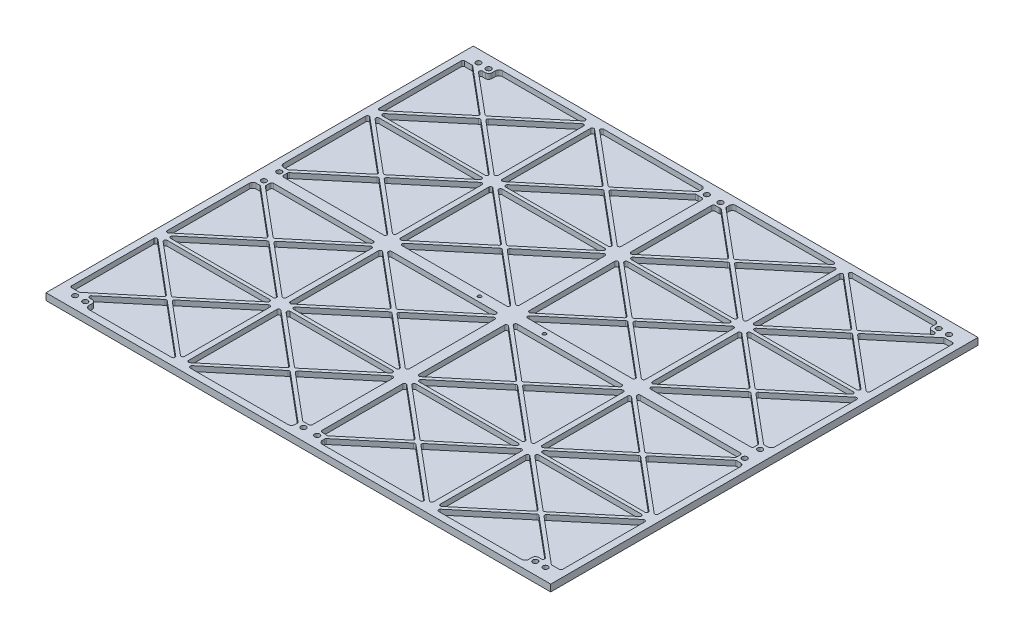
from build123d import *

# Parameters (mm, degrees)
SKETCH1_W               = 295.3
SKETCH1_H               = 250
BOSS_EXTRUDE1_DEPTH     = 4
CUT_EXTRUDE1_DEPTH      = 3
LPATTERN1_COUNT         = 2
LPATTERN1_PITCH         = 72
MIRROR1_COPY_1_DEPTH    = 3
MIRROR2_COPY_1_DEPTH    = 3
MIRROR2_COPY_2_DEPTH    = 3
MIRROR2_COPY_3_DEPTH    = 3
MIRROR3_COPY_1_DEPTH    = 3
MIRROR3_COPY_2_DEPTH    = 3
MIRROR3_COPY_3_DEPTH    = 3
MIRROR3_COPY_4_DEPTH    = 3
MIRROR3_COPY_5_DEPTH    = 3
MIRROR3_COPY_6_DEPTH    = 3
MIRROR3_COPY_7_DEPTH    = 3
SKETCH4_R               = 1.5
BOSS_EXTRUDE2_DEPTH     = 3
CUT_EXTRUDE2_START      = -4
SKETCH4_3_R             = 1.5
CUT_EXTRUDE2_DEPTH      = 4
FILLET1_R               = 1
CUT_EXTRUDE3_DEPTH      = 194.498120146
CUT_EXTRUDE3_DEPTH_BACK = 194.498120146
SKETCH5_R               = 1


with BuildPart() as part:
    # Sketch1 → Boss-Extrude1 (new body)
    with BuildSketch(Plane(origin=(0, 0, 0), x_dir=(1, 0, 0), z_dir=(0, 1, 0))):
        Rectangle(SKETCH1_W, SKETCH1_H)
    extrude(amount=BOSS_EXTRUDE1_DEPTH)

    # Sketch2 → Cut-Extrude1 (cut)
    with BuildSketch(Plane(origin=(0, 4, 0), x_dir=(1, 0, 0), z_dir=(0, 1, 0))):
        with BuildLine():
            Line((-74.825, 66.784773493), (-74.825, 116.715226507))
            ThreePointArc((-74.825, 116.715226507), (-75.402038293, 117.621374063), (-76.467206788, 117.481757942))
            Line((-76.467206788, 117.481757942), (-106.265445093, 92.516531435))
            ThreePointArc((-106.265445093, 92.516531435), (-106.623238305, 91.75), (-106.265445093, 90.983468565))
            Line((-106.265445093, 90.983468565), (-76.467206788, 66.018242058))
            ThreePointArc((-76.467206788, 66.018242058), (-75.402038293, 65.878625937), (-74.825, 66.784773493))
        make_face()
        with BuildLine():
            Line((-143.65, 117.553035315), (-143.65, 65.946964685))
            ThreePointArc((-143.65, 65.946964685), (-143.072961707, 65.040817129), (-142.007793212, 65.18043325))
            Line((-142.007793212, 65.18043325), (-111.209554907, 90.983468565))
            ThreePointArc((-111.209554907, 90.983468565), (-110.851761695, 91.75), (-111.209554907, 92.516531435))
            Line((-111.209554907, 92.516531435), (-142.007793212, 118.31956675))
            ThreePointArc((-142.007793212, 118.31956675), (-143.072961707, 118.459182871), (-143.65, 117.553035315))
        make_face()
        with BuildLine():
            Line((-139.98435535, 119.233468565), (-109.379706788, 93.592624442))
            ThreePointArc((-109.379706788, 93.592624442), (-108.7375, 93.359155878), (-108.095293212, 93.592624442))
            Line((-108.095293212, 93.592624442), (-77.49064465, 119.233468565))
            ThreePointArc((-77.49064465, 119.233468565), (-77.193029265, 120.34166399), (-78.132851438, 121))
            Line((-78.132851438, 121), (-139.342148562, 121))
            ThreePointArc((-139.342148562, 121), (-140.281970735, 120.34166399), (-139.98435535, 119.233468565))
        make_face()
        with BuildLine():
            Line((-108.095293212, 89.907375558), (-78.087439522, 64.766531435))
            ThreePointArc((-78.087439522, 64.766531435), (-77.789824137, 63.65833601), (-78.72964631, 63))
            Line((-78.72964631, 63), (-138.74535369, 63))
            ThreePointArc((-138.74535369, 63), (-139.685175863, 63.65833601), (-139.387560478, 64.766531435))
            Line((-139.387560478, 64.766531435), (-109.379706788, 89.907375558))
            ThreePointArc((-109.379706788, 89.907375558), (-108.7375, 90.140844122), (-108.095293212, 89.907375558))
        make_face()
    cut_extrude1 = extrude(amount=-CUT_EXTRUDE1_DEPTH, mode=Mode.SUBTRACT)

    # LPattern1: Cut-Extrude1 ×2
    with Locations(*[(i * LPATTERN1_PITCH, 0, 0) for i in range(1, LPATTERN1_COUNT)]):
        add(cut_extrude1, mode=Mode.SUBTRACT)

    # Mirror1: Cut-Extrude1 across plane
    add(cut_extrude1.mirror(Plane(origin=(0, 0, -62), x_dir=(1, 0, 0), z_dir=(0, 0, -1))), mode=Mode.SUBTRACT)

    # Mirror1 copy 1 sketch → Mirror1 copy 1 (cut)
    with BuildSketch(Plane(origin=(72, 4, -124), x_dir=(1, 0, 0), z_dir=(0, 1, 0))):
        with BuildLine():
            Line((-74.825, -66.784773493), (-74.825, -116.715226507))
            ThreePointArc((-74.825, -116.715226507), (-75.402038293, -117.621374063), (-76.467206788, -117.481757942))
            Line((-76.467206788, -117.481757942), (-106.265445093, -92.516531435))
            ThreePointArc((-106.265445093, -92.516531435), (-106.623238305, -91.75), (-106.265445093, -90.983468565))
            Line((-106.265445093, -90.983468565), (-76.467206788, -66.018242058))
            ThreePointArc((-76.467206788, -66.018242058), (-75.402038293, -65.878625937), (-74.825, -66.784773493))
        make_face()
        with BuildLine():
            Line((-143.65, -117.553035315), (-143.65, -65.946964685))
            ThreePointArc((-143.65, -65.946964685), (-143.072961707, -65.040817129), (-142.007793212, -65.18043325))
            Line((-142.007793212, -65.18043325), (-111.209554907, -90.983468565))
            ThreePointArc((-111.209554907, -90.983468565), (-110.851761695, -91.75), (-111.209554907, -92.516531435))
            Line((-111.209554907, -92.516531435), (-142.007793212, -118.31956675))
            ThreePointArc((-142.007793212, -118.31956675), (-143.072961707, -118.459182871), (-143.65, -117.553035315))
        make_face()
        with BuildLine():
            Line((-139.98435535, -119.233468565), (-109.379706788, -93.592624442))
            ThreePointArc((-109.379706788, -93.592624442), (-108.7375, -93.359155878), (-108.095293212, -93.592624442))
            Line((-108.095293212, -93.592624442), (-77.49064465, -119.233468565))
            ThreePointArc((-77.49064465, -119.233468565), (-77.193029265, -120.34166399), (-78.132851438, -121))
            Line((-78.132851438, -121), (-139.342148562, -121))
            ThreePointArc((-139.342148562, -121), (-140.281970735, -120.34166399), (-139.98435535, -119.233468565))
        make_face()
        with BuildLine():
            Line((-108.095293212, -89.907375558), (-78.087439522, -64.766531435))
            ThreePointArc((-78.087439522, -64.766531435), (-77.789824137, -63.65833601), (-78.72964631, -63))
            Line((-78.72964631, -63), (-138.74535369, -63))
            ThreePointArc((-138.74535369, -63), (-139.685175863, -63.65833601), (-139.387560478, -64.766531435))
            Line((-139.387560478, -64.766531435), (-109.379706788, -89.907375558))
            ThreePointArc((-109.379706788, -89.907375558), (-108.7375, -90.140844122), (-108.095293212, -89.907375558))
        make_face()
    extrude(amount=-MIRROR1_COPY_1_DEPTH, mode=Mode.SUBTRACT)

    # Mirror2: Cut-Extrude1 across plane
    add(cut_extrude1.mirror(Plane.XY), mode=Mode.SUBTRACT)

    # Mirror2 copy 1 sketch → Mirror2 copy 1 (cut)
    with BuildSketch(Plane(origin=(72, 4, 0), x_dir=(1, 0, 0), z_dir=(0, 1, 0))):
        with BuildLine():
            Line((-74.825, -66.784773493), (-74.825, -116.715226507))
            ThreePointArc((-74.825, -116.715226507), (-75.402038293, -117.621374063), (-76.467206788, -117.481757942))
            Line((-76.467206788, -117.481757942), (-106.265445093, -92.516531435))
            ThreePointArc((-106.265445093, -92.516531435), (-106.623238305, -91.75), (-106.265445093, -90.983468565))
            Line((-106.265445093, -90.983468565), (-76.467206788, -66.018242058))
            ThreePointArc((-76.467206788, -66.018242058), (-75.402038293, -65.878625937), (-74.825, -66.784773493))
        make_face()
        with BuildLine():
            Line((-143.65, -117.553035315), (-143.65, -65.946964685))
            ThreePointArc((-143.65, -65.946964685), (-143.072961707, -65.040817129), (-142.007793212, -65.18043325))
            Line((-142.007793212, -65.18043325), (-111.209554907, -90.983468565))
            ThreePointArc((-111.209554907, -90.983468565), (-110.851761695, -91.75), (-111.209554907, -92.516531435))
            Line((-111.209554907, -92.516531435), (-142.007793212, -118.31956675))
            ThreePointArc((-142.007793212, -118.31956675), (-143.072961707, -118.459182871), (-143.65, -117.553035315))
        make_face()
        with BuildLine():
            Line((-139.98435535, -119.233468565), (-109.379706788, -93.592624442))
            ThreePointArc((-109.379706788, -93.592624442), (-108.7375, -93.359155878), (-108.095293212, -93.592624442))
            Line((-108.095293212, -93.592624442), (-77.49064465, -119.233468565))
            ThreePointArc((-77.49064465, -119.233468565), (-77.193029265, -120.34166399), (-78.132851438, -121))
            Line((-78.132851438, -121), (-139.342148562, -121))
            ThreePointArc((-139.342148562, -121), (-140.281970735, -120.34166399), (-139.98435535, -119.233468565))
        make_face()
        with BuildLine():
            Line((-108.095293212, -89.907375558), (-78.087439522, -64.766531435))
            ThreePointArc((-78.087439522, -64.766531435), (-77.789824137, -63.65833601), (-78.72964631, -63))
            Line((-78.72964631, -63), (-138.74535369, -63))
            ThreePointArc((-138.74535369, -63), (-139.685175863, -63.65833601), (-139.387560478, -64.766531435))
            Line((-139.387560478, -64.766531435), (-109.379706788, -89.907375558))
            ThreePointArc((-109.379706788, -89.907375558), (-108.7375, -90.140844122), (-108.095293212, -89.907375558))
        make_face()
    extrude(amount=-MIRROR2_COPY_1_DEPTH, mode=Mode.SUBTRACT)

    # Mirror2 copy 2 sketch → Mirror2 copy 2 (cut)
    with BuildSketch(Plane(origin=(0, 4, 124), x_dir=(1, 0, 0), z_dir=(0, 1, 0))):
        with BuildLine():
            Line((-74.825, 66.784773493), (-74.825, 116.715226507))
            ThreePointArc((-74.825, 116.715226507), (-75.402038293, 117.621374063), (-76.467206788, 117.481757942))
            Line((-76.467206788, 117.481757942), (-106.265445093, 92.516531435))
            ThreePointArc((-106.265445093, 92.516531435), (-106.623238305, 91.75), (-106.265445093, 90.983468565))
            Line((-106.265445093, 90.983468565), (-76.467206788, 66.018242058))
            ThreePointArc((-76.467206788, 66.018242058), (-75.402038293, 65.878625937), (-74.825, 66.784773493))
        make_face()
        with BuildLine():
            Line((-143.65, 117.553035315), (-143.65, 65.946964685))
            ThreePointArc((-143.65, 65.946964685), (-143.072961707, 65.040817129), (-142.007793212, 65.18043325))
            Line((-142.007793212, 65.18043325), (-111.209554907, 90.983468565))
            ThreePointArc((-111.209554907, 90.983468565), (-110.851761695, 91.75), (-111.209554907, 92.516531435))
            Line((-111.209554907, 92.516531435), (-142.007793212, 118.31956675))
            ThreePointArc((-142.007793212, 118.31956675), (-143.072961707, 118.459182871), (-143.65, 117.553035315))
        make_face()
        with BuildLine():
            Line((-139.98435535, 119.233468565), (-109.379706788, 93.592624442))
            ThreePointArc((-109.379706788, 93.592624442), (-108.7375, 93.359155878), (-108.095293212, 93.592624442))
            Line((-108.095293212, 93.592624442), (-77.49064465, 119.233468565))
            ThreePointArc((-77.49064465, 119.233468565), (-77.193029265, 120.34166399), (-78.132851438, 121))
            Line((-78.132851438, 121), (-139.342148562, 121))
            ThreePointArc((-139.342148562, 121), (-140.281970735, 120.34166399), (-139.98435535, 119.233468565))
        make_face()
        with BuildLine():
            Line((-108.095293212, 89.907375558), (-78.087439522, 64.766531435))
            ThreePointArc((-78.087439522, 64.766531435), (-77.789824137, 63.65833601), (-78.72964631, 63))
            Line((-78.72964631, 63), (-138.74535369, 63))
            ThreePointArc((-138.74535369, 63), (-139.685175863, 63.65833601), (-139.387560478, 64.766531435))
            Line((-139.387560478, 64.766531435), (-109.379706788, 89.907375558))
            ThreePointArc((-109.379706788, 89.907375558), (-108.7375, 90.140844122), (-108.095293212, 89.907375558))
        make_face()
    extrude(amount=-MIRROR2_COPY_2_DEPTH, mode=Mode.SUBTRACT)

    # Mirror2 copy 3 sketch → Mirror2 copy 3 (cut)
    with BuildSketch(Plane(origin=(72, 4, 124), x_dir=(1, 0, 0), z_dir=(0, 1, 0))):
        with BuildLine():
            Line((-74.825, 66.784773493), (-74.825, 116.715226507))
            ThreePointArc((-74.825, 116.715226507), (-75.402038293, 117.621374063), (-76.467206788, 117.481757942))
            Line((-76.467206788, 117.481757942), (-106.265445093, 92.516531435))
            ThreePointArc((-106.265445093, 92.516531435), (-106.623238305, 91.75), (-106.265445093, 90.983468565))
            Line((-106.265445093, 90.983468565), (-76.467206788, 66.018242058))
            ThreePointArc((-76.467206788, 66.018242058), (-75.402038293, 65.878625937), (-74.825, 66.784773493))
        make_face()
        with BuildLine():
            Line((-143.65, 117.553035315), (-143.65, 65.946964685))
            ThreePointArc((-143.65, 65.946964685), (-143.072961707, 65.040817129), (-142.007793212, 65.18043325))
            Line((-142.007793212, 65.18043325), (-111.209554907, 90.983468565))
            ThreePointArc((-111.209554907, 90.983468565), (-110.851761695, 91.75), (-111.209554907, 92.516531435))
            Line((-111.209554907, 92.516531435), (-142.007793212, 118.31956675))
            ThreePointArc((-142.007793212, 118.31956675), (-143.072961707, 118.459182871), (-143.65, 117.553035315))
        make_face()
        with BuildLine():
            Line((-139.98435535, 119.233468565), (-109.379706788, 93.592624442))
            ThreePointArc((-109.379706788, 93.592624442), (-108.7375, 93.359155878), (-108.095293212, 93.592624442))
            Line((-108.095293212, 93.592624442), (-77.49064465, 119.233468565))
            ThreePointArc((-77.49064465, 119.233468565), (-77.193029265, 120.34166399), (-78.132851438, 121))
            Line((-78.132851438, 121), (-139.342148562, 121))
            ThreePointArc((-139.342148562, 121), (-140.281970735, 120.34166399), (-139.98435535, 119.233468565))
        make_face()
        with BuildLine():
            Line((-108.095293212, 89.907375558), (-78.087439522, 64.766531435))
            ThreePointArc((-78.087439522, 64.766531435), (-77.789824137, 63.65833601), (-78.72964631, 63))
            Line((-78.72964631, 63), (-138.74535369, 63))
            ThreePointArc((-138.74535369, 63), (-139.685175863, 63.65833601), (-139.387560478, 64.766531435))
            Line((-139.387560478, 64.766531435), (-109.379706788, 89.907375558))
            ThreePointArc((-109.379706788, 89.907375558), (-108.7375, 90.140844122), (-108.095293212, 89.907375558))
        make_face()
    extrude(amount=-MIRROR2_COPY_3_DEPTH, mode=Mode.SUBTRACT)

    # Mirror3: Cut-Extrude1 across plane
    add(cut_extrude1.mirror(Plane.ZY), mode=Mode.SUBTRACT)

    # Mirror3 copy 1 sketch → Mirror3 copy 1 (cut)
    with BuildSketch(Plane(origin=(-72, 4, 0), x_dir=(-1, 0, 0), z_dir=(0, 1, 0))):
        with BuildLine():
            Line((-74.825, -66.784773493), (-74.825, -116.715226507))
            ThreePointArc((-74.825, -116.715226507), (-75.402038293, -117.621374063), (-76.467206788, -117.481757942))
            Line((-76.467206788, -117.481757942), (-106.265445093, -92.516531435))
            ThreePointArc((-106.265445093, -92.516531435), (-106.623238305, -91.75), (-106.265445093, -90.983468565))
            Line((-106.265445093, -90.983468565), (-76.467206788, -66.018242058))
            ThreePointArc((-76.467206788, -66.018242058), (-75.402038293, -65.878625937), (-74.825, -66.784773493))
        make_face()
        with BuildLine():
            Line((-143.65, -117.553035315), (-143.65, -65.946964685))
            ThreePointArc((-143.65, -65.946964685), (-143.072961707, -65.040817129), (-142.007793212, -65.18043325))
            Line((-142.007793212, -65.18043325), (-111.209554907, -90.983468565))
            ThreePointArc((-111.209554907, -90.983468565), (-110.851761695, -91.75), (-111.209554907, -92.516531435))
            Line((-111.209554907, -92.516531435), (-142.007793212, -118.31956675))
            ThreePointArc((-142.007793212, -118.31956675), (-143.072961707, -118.459182871), (-143.65, -117.553035315))
        make_face()
        with BuildLine():
            Line((-139.98435535, -119.233468565), (-109.379706788, -93.592624442))
            ThreePointArc((-109.379706788, -93.592624442), (-108.7375, -93.359155878), (-108.095293212, -93.592624442))
            Line((-108.095293212, -93.592624442), (-77.49064465, -119.233468565))
            ThreePointArc((-77.49064465, -119.233468565), (-77.193029265, -120.34166399), (-78.132851438, -121))
            Line((-78.132851438, -121), (-139.342148562, -121))
            ThreePointArc((-139.342148562, -121), (-140.281970735, -120.34166399), (-139.98435535, -119.233468565))
        make_face()
        with BuildLine():
            Line((-108.095293212, -89.907375558), (-78.087439522, -64.766531435))
            ThreePointArc((-78.087439522, -64.766531435), (-77.789824137, -63.65833601), (-78.72964631, -63))
            Line((-78.72964631, -63), (-138.74535369, -63))
            ThreePointArc((-138.74535369, -63), (-139.685175863, -63.65833601), (-139.387560478, -64.766531435))
            Line((-139.387560478, -64.766531435), (-109.379706788, -89.907375558))
            ThreePointArc((-109.379706788, -89.907375558), (-108.7375, -90.140844122), (-108.095293212, -89.907375558))
        make_face()
    extrude(amount=-MIRROR3_COPY_1_DEPTH, mode=Mode.SUBTRACT)

    # Mirror3 copy 2 sketch → Mirror3 copy 2 (cut)
    with BuildSketch(Plane(origin=(0, 4, -124), x_dir=(-1, 0, 0), z_dir=(0, 1, 0))):
        with BuildLine():
            Line((-74.825, 66.784773493), (-74.825, 116.715226507))
            ThreePointArc((-74.825, 116.715226507), (-75.402038293, 117.621374063), (-76.467206788, 117.481757942))
            Line((-76.467206788, 117.481757942), (-106.265445093, 92.516531435))
            ThreePointArc((-106.265445093, 92.516531435), (-106.623238305, 91.75), (-106.265445093, 90.983468565))
            Line((-106.265445093, 90.983468565), (-76.467206788, 66.018242058))
            ThreePointArc((-76.467206788, 66.018242058), (-75.402038293, 65.878625937), (-74.825, 66.784773493))
        make_face()
        with BuildLine():
            Line((-143.65, 117.553035315), (-143.65, 65.946964685))
            ThreePointArc((-143.65, 65.946964685), (-143.072961707, 65.040817129), (-142.007793212, 65.18043325))
            Line((-142.007793212, 65.18043325), (-111.209554907, 90.983468565))
            ThreePointArc((-111.209554907, 90.983468565), (-110.851761695, 91.75), (-111.209554907, 92.516531435))
            Line((-111.209554907, 92.516531435), (-142.007793212, 118.31956675))
            ThreePointArc((-142.007793212, 118.31956675), (-143.072961707, 118.459182871), (-143.65, 117.553035315))
        make_face()
        with BuildLine():
            Line((-139.98435535, 119.233468565), (-109.379706788, 93.592624442))
            ThreePointArc((-109.379706788, 93.592624442), (-108.7375, 93.359155878), (-108.095293212, 93.592624442))
            Line((-108.095293212, 93.592624442), (-77.49064465, 119.233468565))
            ThreePointArc((-77.49064465, 119.233468565), (-77.193029265, 120.34166399), (-78.132851438, 121))
            Line((-78.132851438, 121), (-139.342148562, 121))
            ThreePointArc((-139.342148562, 121), (-140.281970735, 120.34166399), (-139.98435535, 119.233468565))
        make_face()
        with BuildLine():
            Line((-108.095293212, 89.907375558), (-78.087439522, 64.766531435))
            ThreePointArc((-78.087439522, 64.766531435), (-77.789824137, 63.65833601), (-78.72964631, 63))
            Line((-78.72964631, 63), (-138.74535369, 63))
            ThreePointArc((-138.74535369, 63), (-139.685175863, 63.65833601), (-139.387560478, 64.766531435))
            Line((-139.387560478, 64.766531435), (-109.379706788, 89.907375558))
            ThreePointArc((-109.379706788, 89.907375558), (-108.7375, 90.140844122), (-108.095293212, 89.907375558))
        make_face()
    extrude(amount=-MIRROR3_COPY_2_DEPTH, mode=Mode.SUBTRACT)

    # Mirror3 copy 3 sketch → Mirror3 copy 3 (cut)
    with BuildSketch(Plane(origin=(-72, 4, -124), x_dir=(-1, 0, 0), z_dir=(0, 1, 0))):
        with BuildLine():
            Line((-74.825, 66.784773493), (-74.825, 116.715226507))
            ThreePointArc((-74.825, 116.715226507), (-75.402038293, 117.621374063), (-76.467206788, 117.481757942))
            Line((-76.467206788, 117.481757942), (-106.265445093, 92.516531435))
            ThreePointArc((-106.265445093, 92.516531435), (-106.623238305, 91.75), (-106.265445093, 90.983468565))
            Line((-106.265445093, 90.983468565), (-76.467206788, 66.018242058))
            ThreePointArc((-76.467206788, 66.018242058), (-75.402038293, 65.878625937), (-74.825, 66.784773493))
        make_face()
        with BuildLine():
            Line((-143.65, 117.553035315), (-143.65, 65.946964685))
            ThreePointArc((-143.65, 65.946964685), (-143.072961707, 65.040817129), (-142.007793212, 65.18043325))
            Line((-142.007793212, 65.18043325), (-111.209554907, 90.983468565))
            ThreePointArc((-111.209554907, 90.983468565), (-110.851761695, 91.75), (-111.209554907, 92.516531435))
            Line((-111.209554907, 92.516531435), (-142.007793212, 118.31956675))
            ThreePointArc((-142.007793212, 118.31956675), (-143.072961707, 118.459182871), (-143.65, 117.553035315))
        make_face()
        with BuildLine():
            Line((-139.98435535, 119.233468565), (-109.379706788, 93.592624442))
            ThreePointArc((-109.379706788, 93.592624442), (-108.7375, 93.359155878), (-108.095293212, 93.592624442))
            Line((-108.095293212, 93.592624442), (-77.49064465, 119.233468565))
            ThreePointArc((-77.49064465, 119.233468565), (-77.193029265, 120.34166399), (-78.132851438, 121))
            Line((-78.132851438, 121), (-139.342148562, 121))
            ThreePointArc((-139.342148562, 121), (-140.281970735, 120.34166399), (-139.98435535, 119.233468565))
        make_face()
        with BuildLine():
            Line((-108.095293212, 89.907375558), (-78.087439522, 64.766531435))
            ThreePointArc((-78.087439522, 64.766531435), (-77.789824137, 63.65833601), (-78.72964631, 63))
            Line((-78.72964631, 63), (-138.74535369, 63))
            ThreePointArc((-138.74535369, 63), (-139.685175863, 63.65833601), (-139.387560478, 64.766531435))
            Line((-139.387560478, 64.766531435), (-109.379706788, 89.907375558))
            ThreePointArc((-109.379706788, 89.907375558), (-108.7375, 90.140844122), (-108.095293212, 89.907375558))
        make_face()
    extrude(amount=-MIRROR3_COPY_3_DEPTH, mode=Mode.SUBTRACT)

    # Mirror3 copy 4 sketch → Mirror3 copy 4 (cut)
    with BuildSketch(Plane(origin=(0, 4, 0), x_dir=(-1, 0, 0), z_dir=(0, 1, 0))):
        with BuildLine():
            Line((-74.825, 66.784773493), (-74.825, 116.715226507))
            ThreePointArc((-74.825, 116.715226507), (-75.402038293, 117.621374063), (-76.467206788, 117.481757942))
            Line((-76.467206788, 117.481757942), (-106.265445093, 92.516531435))
            ThreePointArc((-106.265445093, 92.516531435), (-106.623238305, 91.75), (-106.265445093, 90.983468565))
            Line((-106.265445093, 90.983468565), (-76.467206788, 66.018242058))
            ThreePointArc((-76.467206788, 66.018242058), (-75.402038293, 65.878625937), (-74.825, 66.784773493))
        make_face()
        with BuildLine():
            Line((-143.65, 117.553035315), (-143.65, 65.946964685))
            ThreePointArc((-143.65, 65.946964685), (-143.072961707, 65.040817129), (-142.007793212, 65.18043325))
            Line((-142.007793212, 65.18043325), (-111.209554907, 90.983468565))
            ThreePointArc((-111.209554907, 90.983468565), (-110.851761695, 91.75), (-111.209554907, 92.516531435))
            Line((-111.209554907, 92.516531435), (-142.007793212, 118.31956675))
            ThreePointArc((-142.007793212, 118.31956675), (-143.072961707, 118.459182871), (-143.65, 117.553035315))
        make_face()
        with BuildLine():
            Line((-139.98435535, 119.233468565), (-109.379706788, 93.592624442))
            ThreePointArc((-109.379706788, 93.592624442), (-108.7375, 93.359155878), (-108.095293212, 93.592624442))
            Line((-108.095293212, 93.592624442), (-77.49064465, 119.233468565))
            ThreePointArc((-77.49064465, 119.233468565), (-77.193029265, 120.34166399), (-78.132851438, 121))
            Line((-78.132851438, 121), (-139.342148562, 121))
            ThreePointArc((-139.342148562, 121), (-140.281970735, 120.34166399), (-139.98435535, 119.233468565))
        make_face()
        with BuildLine():
            Line((-108.095293212, 89.907375558), (-78.087439522, 64.766531435))
            ThreePointArc((-78.087439522, 64.766531435), (-77.789824137, 63.65833601), (-78.72964631, 63))
            Line((-78.72964631, 63), (-138.74535369, 63))
            ThreePointArc((-138.74535369, 63), (-139.685175863, 63.65833601), (-139.387560478, 64.766531435))
            Line((-139.387560478, 64.766531435), (-109.379706788, 89.907375558))
            ThreePointArc((-109.379706788, 89.907375558), (-108.7375, 90.140844122), (-108.095293212, 89.907375558))
        make_face()
    extrude(amount=-MIRROR3_COPY_4_DEPTH, mode=Mode.SUBTRACT)

    # Mirror3 copy 5 sketch → Mirror3 copy 5 (cut)
    with BuildSketch(Plane(origin=(-72, 4, 0), x_dir=(-1, 0, 0), z_dir=(0, 1, 0))):
        with BuildLine():
            Line((-74.825, 66.784773493), (-74.825, 116.715226507))
            ThreePointArc((-74.825, 116.715226507), (-75.402038293, 117.621374063), (-76.467206788, 117.481757942))
            Line((-76.467206788, 117.481757942), (-106.265445093, 92.516531435))
            ThreePointArc((-106.265445093, 92.516531435), (-106.623238305, 91.75), (-106.265445093, 90.983468565))
            Line((-106.265445093, 90.983468565), (-76.467206788, 66.018242058))
            ThreePointArc((-76.467206788, 66.018242058), (-75.402038293, 65.878625937), (-74.825, 66.784773493))
        make_face()
        with BuildLine():
            Line((-143.65, 117.553035315), (-143.65, 65.946964685))
            ThreePointArc((-143.65, 65.946964685), (-143.072961707, 65.040817129), (-142.007793212, 65.18043325))
            Line((-142.007793212, 65.18043325), (-111.209554907, 90.983468565))
            ThreePointArc((-111.209554907, 90.983468565), (-110.851761695, 91.75), (-111.209554907, 92.516531435))
            Line((-111.209554907, 92.516531435), (-142.007793212, 118.31956675))
            ThreePointArc((-142.007793212, 118.31956675), (-143.072961707, 118.459182871), (-143.65, 117.553035315))
        make_face()
        with BuildLine():
            Line((-139.98435535, 119.233468565), (-109.379706788, 93.592624442))
            ThreePointArc((-109.379706788, 93.592624442), (-108.7375, 93.359155878), (-108.095293212, 93.592624442))
            Line((-108.095293212, 93.592624442), (-77.49064465, 119.233468565))
            ThreePointArc((-77.49064465, 119.233468565), (-77.193029265, 120.34166399), (-78.132851438, 121))
            Line((-78.132851438, 121), (-139.342148562, 121))
            ThreePointArc((-139.342148562, 121), (-140.281970735, 120.34166399), (-139.98435535, 119.233468565))
        make_face()
        with BuildLine():
            Line((-108.095293212, 89.907375558), (-78.087439522, 64.766531435))
            ThreePointArc((-78.087439522, 64.766531435), (-77.789824137, 63.65833601), (-78.72964631, 63))
            Line((-78.72964631, 63), (-138.74535369, 63))
            ThreePointArc((-138.74535369, 63), (-139.685175863, 63.65833601), (-139.387560478, 64.766531435))
            Line((-139.387560478, 64.766531435), (-109.379706788, 89.907375558))
            ThreePointArc((-109.379706788, 89.907375558), (-108.7375, 90.140844122), (-108.095293212, 89.907375558))
        make_face()
    extrude(amount=-MIRROR3_COPY_5_DEPTH, mode=Mode.SUBTRACT)

    # Mirror3 copy 6 sketch → Mirror3 copy 6 (cut)
    with BuildSketch(Plane(origin=(0, 4, 124), x_dir=(-1, 0, 0), z_dir=(0, 1, 0))):
        with BuildLine():
            Line((-74.825, -66.784773493), (-74.825, -116.715226507))
            ThreePointArc((-74.825, -116.715226507), (-75.402038293, -117.621374063), (-76.467206788, -117.481757942))
            Line((-76.467206788, -117.481757942), (-106.265445093, -92.516531435))
            ThreePointArc((-106.265445093, -92.516531435), (-106.623238305, -91.75), (-106.265445093, -90.983468565))
            Line((-106.265445093, -90.983468565), (-76.467206788, -66.018242058))
            ThreePointArc((-76.467206788, -66.018242058), (-75.402038293, -65.878625937), (-74.825, -66.784773493))
        make_face()
        with BuildLine():
            Line((-143.65, -117.553035315), (-143.65, -65.946964685))
            ThreePointArc((-143.65, -65.946964685), (-143.072961707, -65.040817129), (-142.007793212, -65.18043325))
            Line((-142.007793212, -65.18043325), (-111.209554907, -90.983468565))
            ThreePointArc((-111.209554907, -90.983468565), (-110.851761695, -91.75), (-111.209554907, -92.516531435))
            Line((-111.209554907, -92.516531435), (-142.007793212, -118.31956675))
            ThreePointArc((-142.007793212, -118.31956675), (-143.072961707, -118.459182871), (-143.65, -117.553035315))
        make_face()
        with BuildLine():
            Line((-139.98435535, -119.233468565), (-109.379706788, -93.592624442))
            ThreePointArc((-109.379706788, -93.592624442), (-108.7375, -93.359155878), (-108.095293212, -93.592624442))
            Line((-108.095293212, -93.592624442), (-77.49064465, -119.233468565))
            ThreePointArc((-77.49064465, -119.233468565), (-77.193029265, -120.34166399), (-78.132851438, -121))
            Line((-78.132851438, -121), (-139.342148562, -121))
            ThreePointArc((-139.342148562, -121), (-140.281970735, -120.34166399), (-139.98435535, -119.233468565))
        make_face()
        with BuildLine():
            Line((-108.095293212, -89.907375558), (-78.087439522, -64.766531435))
            ThreePointArc((-78.087439522, -64.766531435), (-77.789824137, -63.65833601), (-78.72964631, -63))
            Line((-78.72964631, -63), (-138.74535369, -63))
            ThreePointArc((-138.74535369, -63), (-139.685175863, -63.65833601), (-139.387560478, -64.766531435))
            Line((-139.387560478, -64.766531435), (-109.379706788, -89.907375558))
            ThreePointArc((-109.379706788, -89.907375558), (-108.7375, -90.140844122), (-108.095293212, -89.907375558))
        make_face()
    extrude(amount=-MIRROR3_COPY_6_DEPTH, mode=Mode.SUBTRACT)

    # Mirror3 copy 7 sketch → Mirror3 copy 7 (cut)
    with BuildSketch(Plane(origin=(-72, 4, 124), x_dir=(-1, 0, 0), z_dir=(0, 1, 0))):
        with BuildLine():
            Line((-74.825, -66.784773493), (-74.825, -116.715226507))
            ThreePointArc((-74.825, -116.715226507), (-75.402038293, -117.621374063), (-76.467206788, -117.481757942))
            Line((-76.467206788, -117.481757942), (-106.265445093, -92.516531435))
            ThreePointArc((-106.265445093, -92.516531435), (-106.623238305, -91.75), (-106.265445093, -90.983468565))
            Line((-106.265445093, -90.983468565), (-76.467206788, -66.018242058))
            ThreePointArc((-76.467206788, -66.018242058), (-75.402038293, -65.878625937), (-74.825, -66.784773493))
        make_face()
        with BuildLine():
            Line((-143.65, -117.553035315), (-143.65, -65.946964685))
            ThreePointArc((-143.65, -65.946964685), (-143.072961707, -65.040817129), (-142.007793212, -65.18043325))
            Line((-142.007793212, -65.18043325), (-111.209554907, -90.983468565))
            ThreePointArc((-111.209554907, -90.983468565), (-110.851761695, -91.75), (-111.209554907, -92.516531435))
            Line((-111.209554907, -92.516531435), (-142.007793212, -118.31956675))
            ThreePointArc((-142.007793212, -118.31956675), (-143.072961707, -118.459182871), (-143.65, -117.553035315))
        make_face()
        with BuildLine():
            Line((-139.98435535, -119.233468565), (-109.379706788, -93.592624442))
            ThreePointArc((-109.379706788, -93.592624442), (-108.7375, -93.359155878), (-108.095293212, -93.592624442))
            Line((-108.095293212, -93.592624442), (-77.49064465, -119.233468565))
            ThreePointArc((-77.49064465, -119.233468565), (-77.193029265, -120.34166399), (-78.132851438, -121))
            Line((-78.132851438, -121), (-139.342148562, -121))
            ThreePointArc((-139.342148562, -121), (-140.281970735, -120.34166399), (-139.98435535, -119.233468565))
        make_face()
        with BuildLine():
            Line((-108.095293212, -89.907375558), (-78.087439522, -64.766531435))
            ThreePointArc((-78.087439522, -64.766531435), (-77.789824137, -63.65833601), (-78.72964631, -63))
            Line((-78.72964631, -63), (-138.74535369, -63))
            ThreePointArc((-138.74535369, -63), (-139.685175863, -63.65833601), (-139.387560478, -64.766531435))
            Line((-139.387560478, -64.766531435), (-109.379706788, -89.907375558))
            ThreePointArc((-109.379706788, -89.907375558), (-108.7375, -90.140844122), (-108.095293212, -89.907375558))
        make_face()
    extrude(amount=-MIRROR3_COPY_7_DEPTH, mode=Mode.SUBTRACT)

    # Sketch4 → Boss-Extrude2 (add)
    # profile 1 of 8: a face of its own
    with BuildSketch(Plane(origin=(0, 4, 0), x_dir=(1, 0, 0), z_dir=(0, 1, 0))):
        with BuildLine():
            Line((130.65, 115), (143.65, 115))
            Line((143.65, 115), (143.65, 121))
            Line((143.65, 121), (126.65, 121))
            ThreePointArc((126.65, 121), (128.064213562, 120.414213562), (128.65, 119))
            Line((128.65, 119), (128.65, 117))
            ThreePointArc((128.65, 117), (129.235786438, 115.585786438), (130.65, 115))
        make_face()
        with Locations(Location((131.65, 118, 0), (0, 0, 270))):
            Circle(SKETCH4_R, mode=Mode.SUBTRACT)
        with Locations((137.65, 118)):
            Circle(SKETCH4_R, mode=Mode.SUBTRACT)
    # profile 2 of 8: a face of its own
    with BuildSketch(Plane(origin=(0, 4, 0), x_dir=(1, 0, 0), z_dir=(0, 1, 0))):
        with BuildLine():
            ThreePointArc((8, 119), (8.585786438, 120.414213562), (10, 121))
            Line((10, 121), (-10, 121))
            ThreePointArc((-10, 121), (-8.585786438, 120.414213562), (-8, 119))
            Line((-8, 119), (-8, 117))
            ThreePointArc((-8, 117), (-7.414213562, 115.585786438), (-6, 115))
            Line((-6, 115), (6, 115))
            ThreePointArc((6, 115), (7.414213562, 115.585786438), (8, 117))
            Line((8, 117), (8, 119))
        make_face()
        with Locations((-4, 118)):
            Circle(SKETCH4_R, mode=Mode.SUBTRACT)
        with Locations((4, 118)):
            Circle(SKETCH4_R, mode=Mode.SUBTRACT)
    # profile 3 of 8: a face of its own
    with BuildSketch(Plane(origin=(0, 4, 0), x_dir=(1, 0, 0), z_dir=(0, 1, 0))):
        with BuildLine():
            Line((141.65, 8), (139.65, 8))
            ThreePointArc((139.65, 8), (138.235786438, 7.414213562), (137.65, 6))
            Line((137.65, 6), (137.65, -6))
            ThreePointArc((137.65, -6), (138.235786438, -7.414213562), (139.65, -8))
            Line((139.65, -8), (141.65, -8))
            ThreePointArc((141.65, -8), (143.064213562, -8.585786438), (143.65, -10))
            Line((143.65, -10), (143.65, 10))
            ThreePointArc((143.65, 10), (143.064213562, 8.585786438), (141.65, 8))
        make_face()
        with Locations((140.65, -4.5)):
            Circle(SKETCH4_R, mode=Mode.SUBTRACT)
        with Locations((140.65, 4.5)):
            Circle(SKETCH4_R, mode=Mode.SUBTRACT)
    # profile 4 of 8: a face of its own
    with BuildSketch(Plane(origin=(0, 4, 0), x_dir=(1, 0, 0), z_dir=(0, 1, 0))):
        with BuildLine():
            Line((143.65, -121), (143.65, -115))
            Line((143.65, -115), (130.65, -115))
            ThreePointArc((130.65, -115), (129.235786438, -115.585786438), (128.65, -117))
            Line((128.65, -117), (128.65, -119))
            ThreePointArc((128.65, -119), (128.064213562, -120.414213562), (126.65, -121))
            Line((126.65, -121), (143.65, -121))
        make_face()
        with Locations(Location((131.65, -118, 0), (0, 0, 270))):
            Circle(SKETCH4_R, mode=Mode.SUBTRACT)
        with Locations((137.65, -118)):
            Circle(SKETCH4_R, mode=Mode.SUBTRACT)
    # profile 5 of 8: a face of its own
    with BuildSketch(Plane(origin=(0, 4, 0), x_dir=(1, 0, 0), z_dir=(0, 1, 0))):
        with BuildLine():
            Line((-10, -121), (10, -121))
            ThreePointArc((10, -121), (8.585786438, -120.414213562), (8, -119))
            Line((8, -119), (8, -117))
            ThreePointArc((8, -117), (7.414213562, -115.585786438), (6, -115))
            Line((6, -115), (-6, -115))
            ThreePointArc((-6, -115), (-7.414213562, -115.585786438), (-8, -117))
            Line((-8, -117), (-8, -119))
            ThreePointArc((-8, -119), (-8.585786438, -120.414213562), (-10, -121))
        make_face()
        with Locations((-4, -118)):
            Circle(SKETCH4_R, mode=Mode.SUBTRACT)
        with Locations((4, -118)):
            Circle(SKETCH4_R, mode=Mode.SUBTRACT)
    # profile 6 of 8: a face of its own
    with BuildSketch(Plane(origin=(0, 4, 0), x_dir=(1, 0, 0), z_dir=(0, 1, 0))):
        with BuildLine():
            Line((-143.65, -121), (-126.65, -121))
            ThreePointArc((-126.65, -121), (-128.064213562, -120.414213562), (-128.65, -119))
            Line((-128.65, -119), (-128.65, -117))
            ThreePointArc((-128.65, -117), (-129.235786438, -115.585786438), (-130.65, -115))
            Line((-130.65, -115), (-143.65, -115))
            Line((-143.65, -115), (-143.65, -121))
        make_face()
        with Locations((-137.65, -118)):
            Circle(SKETCH4_R, mode=Mode.SUBTRACT)
        with Locations(Location((-131.65, -118, 0), (0, 0, 270))):
            Circle(SKETCH4_R, mode=Mode.SUBTRACT)
    # profile 7 of 8: a face of its own
    with BuildSketch(Plane(origin=(0, 4, 0), x_dir=(1, 0, 0), z_dir=(0, 1, 0))):
        with BuildLine():
            ThreePointArc((-128.65, 119), (-128.064213562, 120.414213562), (-126.65, 121))
            Line((-126.65, 121), (-143.65, 121))
            Line((-143.65, 121), (-143.65, 115))
            Line((-143.65, 115), (-130.65, 115))
            ThreePointArc((-130.65, 115), (-129.235786438, 115.585786438), (-128.65, 117))
            Line((-128.65, 117), (-128.65, 119))
        make_face()
        with Locations((-137.65, 118)):
            Circle(SKETCH4_R, mode=Mode.SUBTRACT)
        with Locations(Location((-131.65, 118, 0), (0, 0, 270))):
            Circle(SKETCH4_R, mode=Mode.SUBTRACT)
    # profile 8 of 8: a face of its own
    with BuildSketch(Plane(origin=(0, 4, 0), x_dir=(1, 0, 0), z_dir=(0, 1, 0))):
        with BuildLine():
            ThreePointArc((-141.65, 8), (-143.064213562, 8.585786438), (-143.65, 10))
            Line((-143.65, 10), (-143.65, -10))
            ThreePointArc((-143.65, -10), (-143.064213562, -8.585786438), (-141.65, -8))
            Line((-141.65, -8), (-139.65, -8))
            ThreePointArc((-139.65, -8), (-138.235786438, -7.414213562), (-137.65, -6))
            Line((-137.65, -6), (-137.65, 6))
            ThreePointArc((-137.65, 6), (-138.235786438, 7.414213562), (-139.65, 8))
            Line((-139.65, 8), (-141.65, 8))
        make_face()
        with Locations((-140.65, -4.5)):
            Circle(SKETCH4_R, mode=Mode.SUBTRACT)
        with Locations((-140.65, 4.5)):
            Circle(SKETCH4_R, mode=Mode.SUBTRACT)
    extrude(amount=-BOSS_EXTRUDE2_DEPTH)

    # Sketch4<3> → Cut-Extrude2 (cut)
    with BuildSketch(Plane(origin=(0, 4, 0), x_dir=(1, 0, 0), z_dir=(0, 1, 0)).offset(CUT_EXTRUDE2_START)):
        with Locations(Location((-140.65, -4.5, 0), (0, 0, 270))):
            Circle(SKETCH4_3_R)
        with Locations(Location((-140.65, 4.5, 0), (0, 0, 270))):
            Circle(SKETCH4_3_R)
        with Locations(Location((-137.65, 118, 0), (0, 0, 270))):
            Circle(SKETCH4_3_R)
        with Locations(Location((-131.65, 118, 0), (0, 0, 270))):
            Circle(SKETCH4_3_R)
        with Locations(Location((-4, 118, 0), (0, 0, 270))):
            Circle(SKETCH4_3_R)
        with Locations(Location((4, 118, 0), (0, 0, 270))):
            Circle(SKETCH4_3_R)
        with Locations(Location((131.65, 118, 0), (0, 0, 270))):
            Circle(SKETCH4_3_R)
        with Locations(Location((137.65, 118, 0), (0, 0, 270))):
            Circle(SKETCH4_3_R)
        with Locations(Location((140.65, 4.5, 0), (0, 0, 270))):
            Circle(SKETCH4_3_R)
        with Locations(Location((140.65, -4.5, 0), (0, 0, 270))):
            Circle(SKETCH4_3_R)
        with Locations(Location((137.65, -118, 0), (0, 0, 270))):
            Circle(SKETCH4_3_R)
        with Locations(Location((131.65, -118, 0), (0, 0, 270))):
            Circle(SKETCH4_3_R)
        with Locations(Location((4, -118, 0), (0, 0, 270))):
            Circle(SKETCH4_3_R)
        with Locations(Location((-4, -118, 0), (0, 0, 270))):
            Circle(SKETCH4_3_R)
        with Locations(Location((-137.65, -118, 0), (0, 0, 270))):
            Circle(SKETCH4_3_R)
        with Locations(Location((-131.65, -118, 0), (0, 0, 270))):
            Circle(SKETCH4_3_R)
    extrude(amount=CUT_EXTRUDE2_DEPTH, mode=Mode.SUBTRACT)

    # Fillet1
    fillet1_edges = [part.edges().sort_by_distance(p)[0] for p in [
        (-143.65, 2.5, 115),
        (-138.045592386, 2.5, 115),
        (-134.931330691, 2.5, 115),
        (-138.045592386, 2.5, -115),
        (-134.931330691, 2.5, -115),
        (-143.65, 2.5, -115),
        (-139.280317149, 2.5, -7.965536718),
        (-137.753633997, 2.5, 6.635449432),
        (-137.65, 2.5, 3),
        (-139.280317149, 2.5, 7.965536718),
        (-137.65, 2.5, -3),
        (-137.753633997, 2.5, -6.635449432),
        (2.825, 2.5, 115),
        (8, 2.5, 117.131108551),
        (7.063747901, 2.5, 115.306352928),
        (-2.825, 2.5, 115),
        (-7.063747901, 2.5, 115.306352928),
        (-8, 2.5, 117.131108551),
        (138.045592386, 2.5, 115),
        (134.931330691, 2.5, 115),
        (143.65, 2.5, 115),
        (139.280317149, 2.5, 7.965536718),
        (137.753633997, 2.5, -6.635449432),
        (137.65, 2.5, -3),
        (139.280317149, 2.5, -7.965536718),
        (137.65, 2.5, 3),
        (137.753633997, 2.5, 6.635449432),
        (-8, 2.5, -117.131108551),
        (-2.825, 2.5, -115),
        (-7.063747901, 2.5, -115.306352928),
        (2.825, 2.5, -115),
        (7.063747901, 2.5, -115.306352928),
        (8, 2.5, -117.131108551),
        (143.65, 2.5, -115),
        (138.045592386, 2.5, -115),
        (134.931330691, 2.5, -115),
    ]]
    fillet(fillet1_edges, radius=FILLET1_R)

    # Sketch5 → Cut-Extrude3 (cut, two sides: drawn at the far end of the back side and taken through both)
    with BuildSketch(Plane(origin=(0, 4, 0), x_dir=(1, 0, 0), z_dir=(0, 1, 0)).offset(-CUT_EXTRUDE3_DEPTH_BACK)):
        with Locations(Location((19, 0, 0), (0, 0, 270))):
            Circle(SKETCH5_R)
        with Locations(Location((-19, 0, 0), (0, 0, 270))):
            Circle(SKETCH5_R)
    extrude(amount=CUT_EXTRUDE3_DEPTH + CUT_EXTRUDE3_DEPTH_BACK, mode=Mode.SUBTRACT)


solid = part.part
